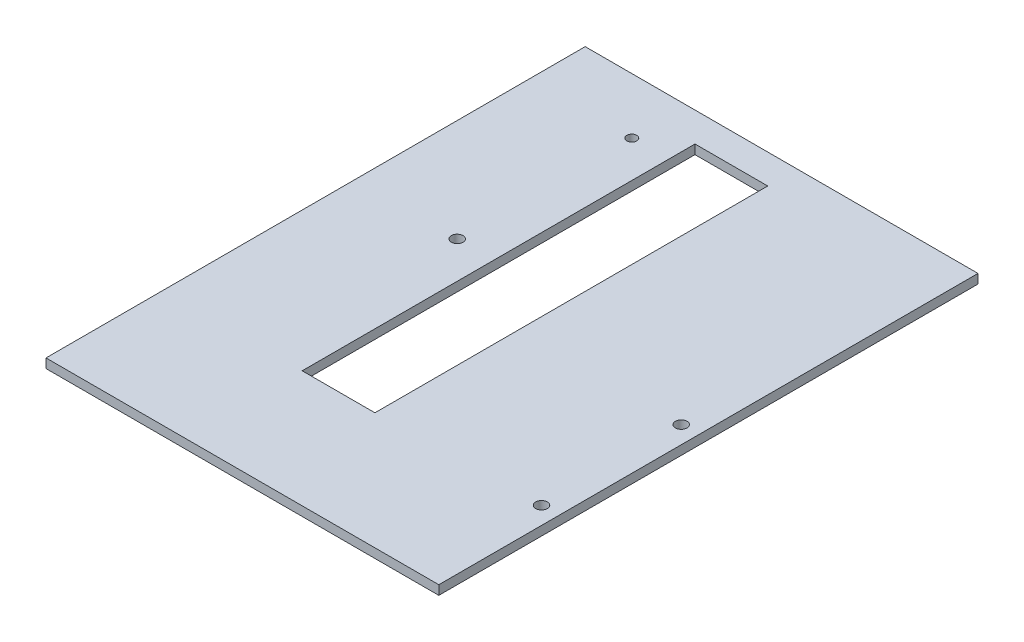
from build123d import *

# Parameters (mm, degrees)
SKETCH1_R           = 2
SKETCH1_R_2         = 1.7
SKETCH1_W           = 25
SKETCH1_H           = 135
BOSS_EXTRUDE1_DEPTH = 3.175


with BuildPart() as part:
    # Sketch1 → Boss-Extrude1 (new body)
    with BuildSketch(Plane(origin=(0, 0, 0), x_dir=(1, 0, 0), z_dir=(0, 1, 0))):
        Polygon((67.674333466, 92.651811553), (67.674333466, -92.651811553), (-67.325666534, -92.651811553), (-67.325666534, -57.348188447), (-67.325666534, 92.651811553), align=None)
        with Locations((61.674333466, -3.348188447)):
            Circle(SKETCH1_R, mode=Mode.SUBTRACT)
        with Locations((61.674333466, -51.348188447)):
            Circle(SKETCH1_R, mode=Mode.SUBTRACT)
        with Locations((-32.086624165, 13.427366475)):
            Circle(SKETCH1_R, mode=Mode.SUBTRACT)
        with Locations((-32.086624165, 73.427366475)):
            Circle(SKETCH1_R_2, mode=Mode.SUBTRACT)
        with Locations((-6.974333466, 15.039519235)):
            Rectangle(SKETCH1_W, SKETCH1_H, mode=Mode.SUBTRACT)
    extrude(amount=BOSS_EXTRUDE1_DEPTH)


solid = part.part
